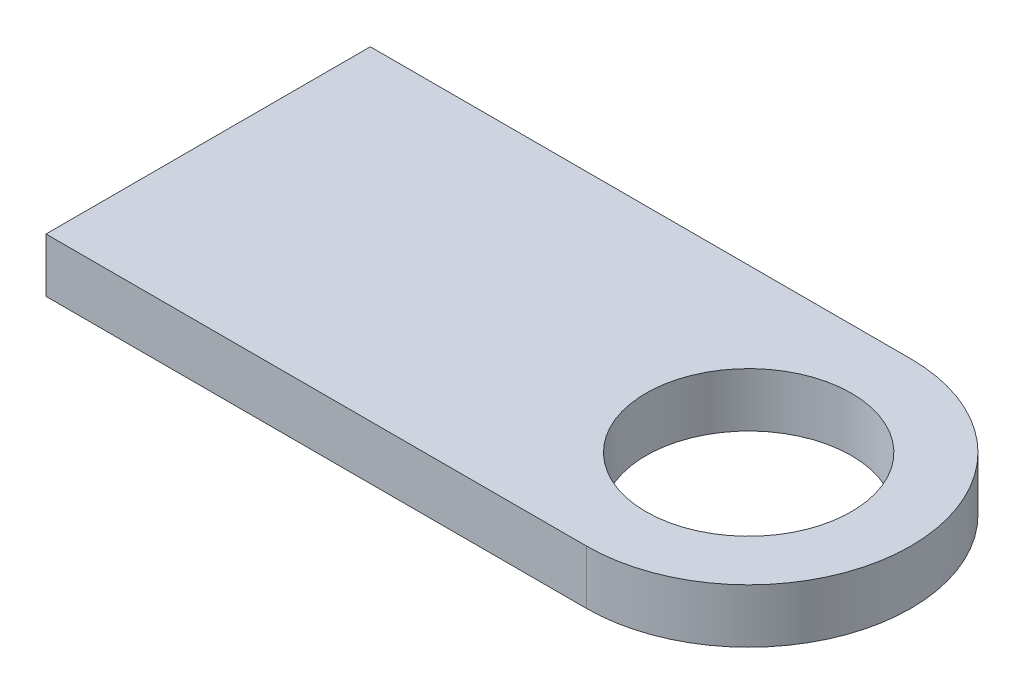
from build123d import *

# Parameters (mm, degrees)
SKETCH1_R           = 9.5
BOSS_EXTRUDE1_DEPTH = 5


with BuildPart() as part:
    # Sketch1 → Boss-Extrude1 (new body)
    with BuildSketch(Plane(origin=(0, 0, 0), x_dir=(1, 0, 0), z_dir=(0, 1, 0))):
        with BuildLine():
            Line((-50, -15), (0, -15))
            ThreePointArc((0, -15), (15, 0), (0, 15))
            Line((0, 15), (-50, 15))
            Line((-50, 15), (-50, -15))
        make_face()
        Circle(SKETCH1_R, mode=Mode.SUBTRACT)
    extrude(amount=BOSS_EXTRUDE1_DEPTH)


solid = part.part
